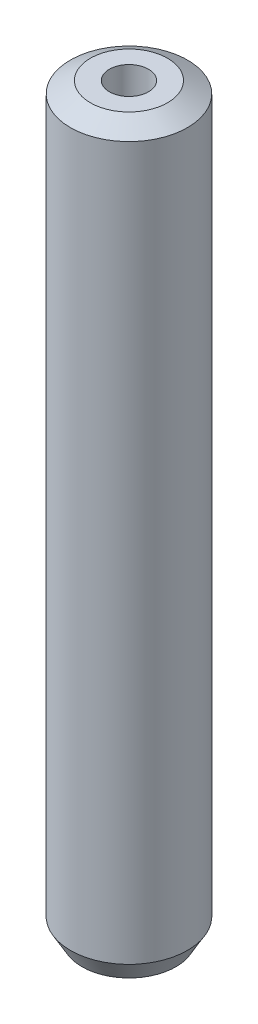
from build123d import *
from OCP.BRepFilletAPI import BRepFilletAPI_MakeChamfer

# Parameters (mm, degrees)
SKETCH1_R           = 30
BOSS_EXTRUDE1_DEPTH = 381.160073081
SKETCH2_R           = 10.037587738
CUT_EXTRUDE1_DEPTH  = 384.514017098
CHAMFER1_SIZE       = 5.903739884
CHAMFER1_SIZE2      = 10.225577434


with BuildPart() as part:
    # Sketch1 → Boss-Extrude1 (new body)
    with BuildSketch(Plane(origin=(0, 0, 0), x_dir=(1, 0, 0), z_dir=(0, 1, 0))):
        Circle(SKETCH1_R)
    extrude(amount=BOSS_EXTRUDE1_DEPTH)

    # Sketch2 → Cut-Extrude1 (cut, through all)
    with BuildSketch(Plane(origin=(0, 0, 0), x_dir=(1, 0, 0), z_dir=(0, 1, 0))):
        Circle(SKETCH2_R)
    extrude(amount=CUT_EXTRUDE1_DEPTH, mode=Mode.SUBTRACT)

    # Chamfer1: one chamfer whose edges measure the first distance from different faces: ONE call of the kernel's chamfer builder (chamfer() names one face for all edges)
    chamfer1_edges_1 = [part.edges().sort_by_distance(p)[0] for p in [
        (-30, 381.160073081, 0),
    ]]
    chamfer1_side_1 = [part.faces().sort_by_distance(p)[0] for p in [
        (-30, 190.58003654, 0),
    ]]
    chamfer1_edges_2 = [part.edges().sort_by_distance(p)[0] for p in [
        (-30, 0, 0),
    ]]
    chamfer1_side_2 = [part.faces().sort_by_distance(p)[0] for p in [
        (-29.151471863, 0, 0),
    ]]
    chamfer1 = BRepFilletAPI_MakeChamfer(part.part.solid().wrapped)
    for e in chamfer1_edges_1:
        chamfer1.Add(CHAMFER1_SIZE, CHAMFER1_SIZE2, e.wrapped, chamfer1_side_1[0].wrapped)  # the first distance lies on this face
    for e in chamfer1_edges_2:
        chamfer1.Add(CHAMFER1_SIZE, CHAMFER1_SIZE2, e.wrapped, chamfer1_side_2[0].wrapped)  # the first distance lies on this face
    add(Compound.cast(chamfer1.Shape()), mode=Mode.REPLACE)


solid = part.part
